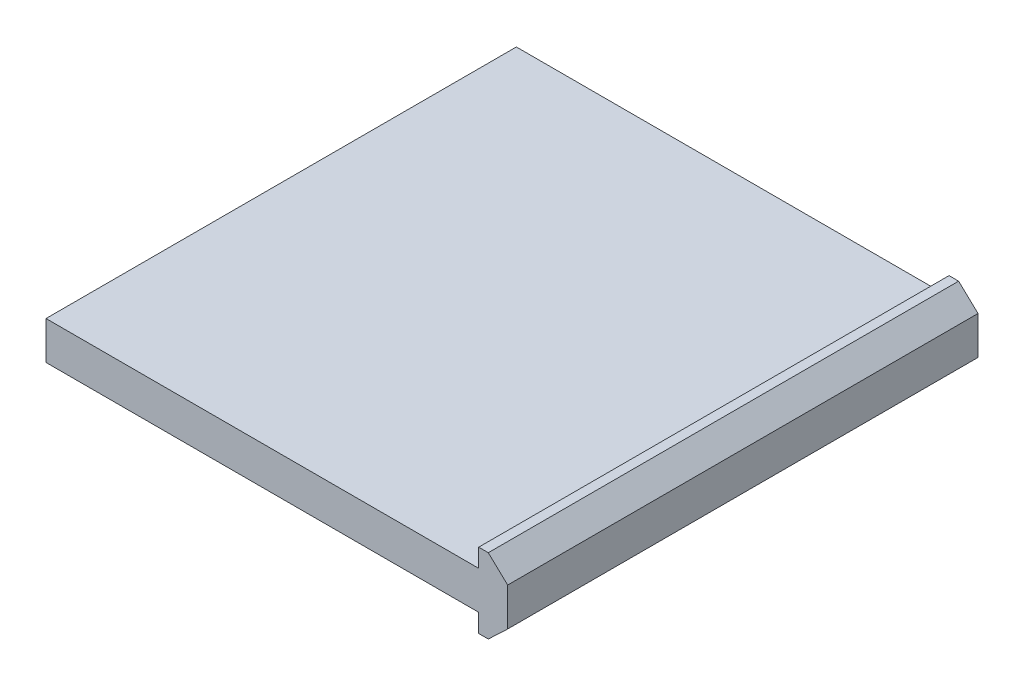
from build123d import *

# Parameters (mm, degrees)
BOSS_EXTRUDE1_DEPTH = 100


with BuildPart() as part:
    # Sketch1 → Boss-Extrude1 (new body)
    with BuildSketch(Plane.XY):
        Polygon((-92, -4.05), (0, -4.05), (0, -7.95), (2.04, -7.95), (6.152414984, -4.048), (6.152414984, 4.048), (2.04, 7.95), (0, 7.95), (0, 4.05), (-92, 4.05), align=None)
    extrude(amount=BOSS_EXTRUDE1_DEPTH)


solid = part.part
